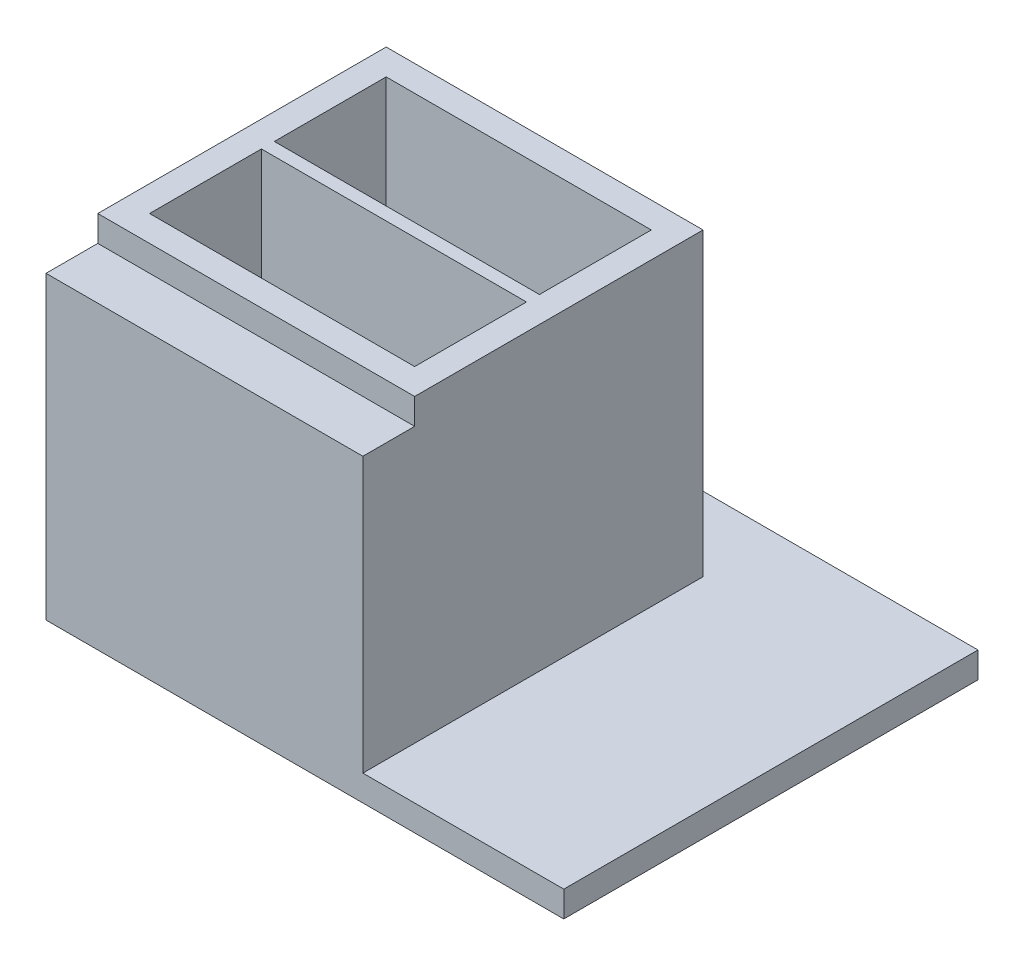
from build123d import *

# Parameters (mm, degrees)
SKETCH1_W           = 63.5
SKETCH1_H           = 44.45
SKETCH1_W_2         = 32.512
SKETCH1_H_2         = 13.716
BOSS_EXTRUDE1_DEPTH = 40.005
SKETCH2_W           = 32.512
SKETCH2_H           = 13.716
BOSS_EXTRUDE2_DEPTH = 2.54
CUT_EXTRUDE1_DEPTH  = 36.83
BOSS_EXTRUDE8_DEPTH = 6.35


with BuildPart() as part:
    # Sketch1 → Boss-Extrude1 (new body)
    with BuildSketch(Plane(origin=(0, 0, 0), x_dir=(1, 0, 0), z_dir=(0, 1, 0))):
        with Locations((31.75, 22.225)):
            Rectangle(SKETCH1_W, SKETCH1_H)
        with Locations((19.431, 10.033)):
            Rectangle(SKETCH1_W_2, SKETCH1_H_2, mode=Mode.SUBTRACT)
        with Locations((19.431, 25.3365)):
            Rectangle(SKETCH1_W_2, SKETCH1_H_2, mode=Mode.SUBTRACT)
    extrude(amount=BOSS_EXTRUDE1_DEPTH)

    # Sketch2 → Boss-Extrude2 (add)
    with BuildSketch(Plane.XZ):
        with Locations((19.431, -25.3365)):
            Rectangle(SKETCH2_W, SKETCH2_H)
        with Locations((19.431, -10.033)):
            Rectangle(SKETCH2_W, SKETCH2_H)
    extrude(amount=-BOSS_EXTRUDE2_DEPTH)

    # Sketch3 → Cut-Extrude1 (cut)
    with BuildSketch(Plane(origin=(0, 40.005, 0), x_dir=(1, 0, 0), z_dir=(0, 1, 0))):
        Polygon((3.175, 35.3695), (35.687, 35.3695), (38.862, 35.3695), (38.862, 32.1945), (38.862, 18.4785), (38.862, 0), (63.5, 0), (63.5, 44.45), (0, 44.45), (0, 35.3695), align=None)
    extrude(amount=-CUT_EXTRUDE1_DEPTH, mode=Mode.SUBTRACT)

    # Sketch9 → Boss-Extrude8 (add)
    with BuildSketch(Plane.XY):
        Polygon((38.862, 36.83), (0, 36.83), (0, 0), (63.5, 0), (63.5, 3.175), (38.862, 3.175), align=None)
    extrude(amount=BOSS_EXTRUDE8_DEPTH)


solid = part.part
